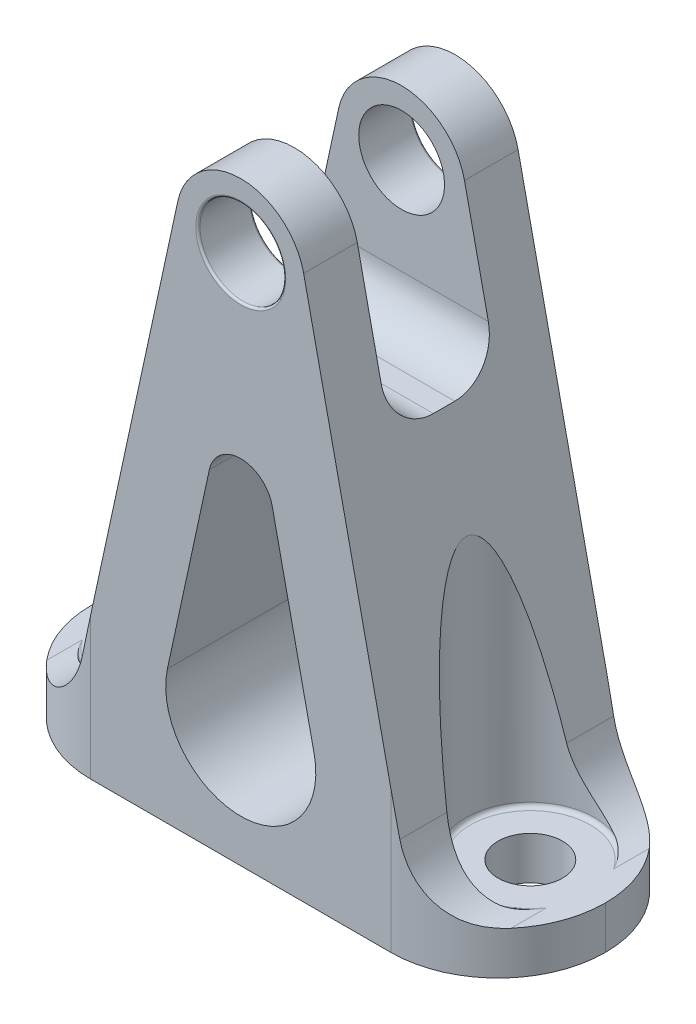
from build123d import *

# Parameters (mm, degrees)
SZKIC1_R                    = 4
DODANIE_WYCI_GNI_CIE1_DEPTH = 20
SZKIC2_W                    = 28.4
SZKIC2_H                    = 10
WYTNIJ_WYCI_GNI_CIE1_DEPTH  = 22
SZKIC3_R                    = 3
WYTNIJ_WYCI_GNI_CIE2_DEPTH  = 89.667893976
SZKIC4_R                    = 6
WYTNIJ_WYCI_GNI_CIE3_DEPTH  = 54.5
WYTNIJ_WYCI_GNI_CIE5_DEPTH  = 74.489764063
ZAOKR_GLENIE1_R             = 10
WYTNIJ_WYCI_GNI_CIE6_DEPTH  = 74.489764063
ZAOKR_GLENIE2_R             = 7
ZAOKR_GLENIE3_R             = 4
ZAOKR_GLENIE4_R             = 0.4
ZAOKR_GLENIE5_R             = 0.2


with BuildPart() as part:
    # Szkic1 → Dodanie-wyciągnięcie1 (new body)
    with BuildSketch(Plane.XY):
        Polygon((15.55899167, -31), (63.55899167, -31), (63.55899167, -27), (48.75899167, 4.5), (48.75899167, 27.5), (30.35899167, 27.5), (30.35899167, 4.5), (15.55899167, -27), align=None)
        with Locations((39.55899167, 18.5)):
            Circle(SZKIC1_R, mode=Mode.SUBTRACT)
    extrude(amount=DODANIE_WYCI_GNI_CIE1_DEPTH)

    # Szkic2 → Wytnij-wyciągnięcie1 (cut)
    with BuildSketch(Plane(origin=(0, 27.5, 0), x_dir=(1, 0, 0), z_dir=(0, 1, 0))):
        with Locations((39.55899167, -10)):
            Rectangle(SZKIC2_W, SZKIC2_H)
    extrude(amount=-WYTNIJ_WYCI_GNI_CIE1_DEPTH, mode=Mode.SUBTRACT)

    # Szkic3 → Wytnij-wyciągnięcie2 (cut, through all)
    with BuildSketch(Plane(origin=(0, 27.5, 0), x_dir=(1, 0, 0), z_dir=(0, 1, 0))):
        with Locations(Location((56.55899167, -10, 0), (0, 0, 270))):
            Circle(SZKIC3_R)
        with Locations(Location((22.55899167, -10, 0), (0, 0, 270))):
            Circle(SZKIC3_R)
    extrude(amount=-WYTNIJ_WYCI_GNI_CIE2_DEPTH, mode=Mode.SUBTRACT)

    # Szkic4 → Wytnij-wyciągnięcie3 (cut)
    with BuildSketch(Plane(origin=(0, 27.5, 0), x_dir=(1, 0, 0), z_dir=(0, 1, 0))):
        with Locations(Location((56.55899167, -10, 0), (0, 0, 270))):
            Circle(SZKIC4_R)
        with Locations(Location((22.55899167, -10, 0), (0, 0, 270))):
            Circle(SZKIC4_R)
    extrude(amount=-WYTNIJ_WYCI_GNI_CIE3_DEPTH, mode=Mode.SUBTRACT)

    # Szkic6 → Wytnij-wyciągnięcie5 (cut, through all)
    with BuildSketch(Plane(origin=(0, 0, 0), x_dir=(-1, 0, 0), z_dir=(0, 0, -1))):
        with BuildLine():
            Line((-63.55899167, -27), (-55.55899167, -27))
            Line((-55.55899167, -27), (-45.422866973, 19.770813293))
            ThreePointArc((-45.422866973, 19.770813293), (-39.55899167, 24.5), (-33.695116367, 19.770813293))
            Line((-33.695116367, 19.770813293), (-23.55899167, -27))
            Line((-23.55899167, -27), (-15.55899167, -27))
            Line((-15.55899167, -27), (-15.55899167, 33))
            Line((-15.55899167, 33), (-63.55899167, 33))
            Line((-63.55899167, 33), (-63.55899167, -27))
        make_face()
    extrude(amount=-WYTNIJ_WYCI_GNI_CIE5_DEPTH, mode=Mode.SUBTRACT)

    # Zaokrąglenie1
    # the kernel refuses this fillet: 10 mm, written as the material it takes off along each edge
    with BuildSketch(Plane(origin=(63.55899167, -56, 20), x_dir=(0, 0, -1), z_dir=(0, 1, 0)), Plane(origin=(15.55899167, -2, 0), x_dir=(1, 0, 0), z_dir=(0, -1, 0))) as zaokr_glenie1_piece_1:
        with BuildLine():
            CenterArc((ZAOKR_GLENIE1_R, ZAOKR_GLENIE1_R), ZAOKR_GLENIE1_R, 180, 90)
            Line((0, ZAOKR_GLENIE1_R), (0, 0))
            Line((0, 0), (ZAOKR_GLENIE1_R, 0))
        make_face()
    extrude(amount=54, mode=Mode.SUBTRACT)
    with BuildSketch(Plane(origin=(63.55899167, -56, 0), x_dir=(0, 0, 1), z_dir=(0, 1, 0)), Plane(origin=(15.55899167, -2, 20), x_dir=(1, 0, 0), z_dir=(0, -1, 0))) as zaokr_glenie1_piece_2:
        with BuildLine():
            CenterArc((ZAOKR_GLENIE1_R, -ZAOKR_GLENIE1_R), ZAOKR_GLENIE1_R, 90, 90)
            Line((0, -ZAOKR_GLENIE1_R), (0, 0))
            Line((0, 0), (ZAOKR_GLENIE1_R, 0))
        make_face()
    extrude(amount=54, mode=Mode.SUBTRACT)

    # Szkic7 → Wytnij-wyciągnięcie6 (cut, through all)
    with BuildSketch(Plane(origin=(0, 0, 0), x_dir=(-1, 0, 0), z_dir=(0, 0, -1))):
        with BuildLine():
            Line((-46.400179524, -18.517384491), (-42.490929322, -0.479049644))
            ThreePointArc((-42.490929322, -0.479049644), (-39.55899167, 1.885543709), (-36.627054018, -0.479049644))
            Line((-36.627054018, -0.479049644), (-32.717803816, -18.517384491))
            ThreePointArc((-32.717803816, -18.517384491), (-39.55899167, -27), (-46.400179524, -18.517384491))
        make_face()
    extrude(amount=-WYTNIJ_WYCI_GNI_CIE6_DEPTH, mode=Mode.SUBTRACT)

    # Zaokrąglenie2
    zaokr_glenie2_edges = [part.edges().sort_by_distance(p)[0] for p in [
        (55.55899167, -27, 17.857019377),
        (55.55899167, -27, 2.142980623),
        (23.55899167, -27, 17.857019377),
        (23.55899167, -27, 2.142980623),
    ]]
    fillet(zaokr_glenie2_edges, radius=ZAOKR_GLENIE2_R)

    # Zaokrąglenie3
    zaokr_glenie3_edges = [part.edges().sort_by_distance(p)[0] for p in [
        (39.55899167, 5.5, 5),
        (39.55899167, 5.5, 15),
    ]]
    fillet(zaokr_glenie3_edges, radius=ZAOKR_GLENIE3_R)

    # Zaokrąglenie4
    zaokr_glenie4_edges = [part.edges().sort_by_distance(p)[0] for p in [
        (50.55899167, -27, 10),
        (28.55899167, -27, 10),
    ]]
    fillet(zaokr_glenie4_edges, radius=ZAOKR_GLENIE4_R)

    # Zaokrąglenie5
    zaokr_glenie5_edges = [part.edges().sort_by_distance(p)[0] for p in [
        (35.55899167, 18.5, 0),
        (35.55899167, 18.5, 20),
        (35.55899167, 18.5, 15),
    ]]
    fillet(zaokr_glenie5_edges, radius=ZAOKR_GLENIE5_R)


solid = part.part
